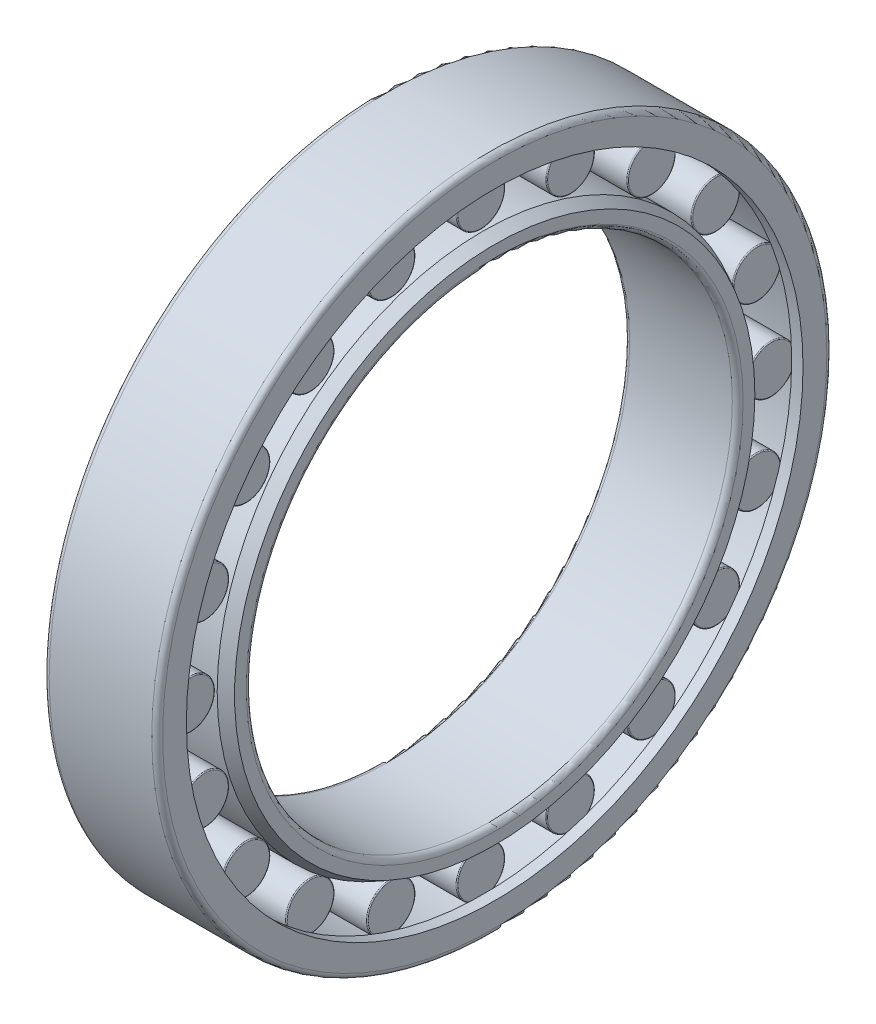
from build123d import *

# Parameters (mm, degrees)
ROLLERSDETAILED_COUNT = 20
ROLLERSDETAILED_ANGLE = 342


with BuildPart() as part:
    # OutRacSke → OuterRace (revolve)
    with BuildSketch(Plane.XY):
        with BuildLine():
            Line((-16.8, 114.18875), (-21, 114.18875))
            Line((-21, 114.18875), (-21, 123))
            ThreePointArc((-21, 123), (-20.414213562, 124.414213562), (-19, 125))
            Line((-19, 125), (19, 125))
            ThreePointArc((19, 125), (20.414213562, 124.414213562), (21, 123))
            Line((21, 123), (21, 114.18875))
            Line((21, 114.18875), (16.8, 114.18875))
            Line((16.8, 114.18875), (16.8, 116.42))
            Line((16.8, 116.42), (-16.8, 116.42))
            Line((-16.8, 116.42), (-16.8, 114.18875))
        make_face()
    revolve(axis=Axis((-90, 0, 0), (1, 0, 0)))

    # RolDetSke → RollerDetailed (revolve)
    with BuildSketch(Plane.XY):
        with BuildLine():
            Line((-15.96, 116.068), (-15.96, 107.5))
            Line((-15.96, 107.5), (15.96, 107.5))
            Line((15.96, 107.5), (15.96, 116.068))
            ThreePointArc((15.96, 116.068), (15.855437121, 116.320437121), (15.603, 116.425))
            Line((15.603, 116.425), (-15.603, 116.425))
            ThreePointArc((-15.603, 116.425), (-15.855437121, 116.320437121), (-15.96, 116.068))
        make_face()
    rollerdetailed = revolve(axis=Axis((-33.6, 107.5, 0), (1, 0, 0)))

    # InsRacSke → InnerRace (revolve)
    with BuildSketch(Plane.XY):
        with BuildLine():
            Line((-16.8, 98.58), (-21, 96.34875))
            Line((-21, 96.34875), (-21, 92))
            ThreePointArc((-21, 92), (-20.414213562, 90.585786438), (-19, 90))
            Line((-19, 90), (19, 90))
            ThreePointArc((19, 90), (20.414213562, 90.585786438), (21, 92))
            Line((21, 92), (21, 96.34875))
            Line((21, 96.34875), (16.8, 98.58))
            Line((16.8, 98.58), (-16.8, 98.58))
        make_face()
    revolve(axis=Axis((-90, 0, 0), (1, 0, 0)))

    # RollersDetailed: RollerDetailed ×20 about axis
    rollersdetailed_axis = Axis((-50, 0, 0), (1, 0, 0))
    for i in range(1, ROLLERSDETAILED_COUNT):
        add(rollerdetailed.rotate(rollersdetailed_axis, i * ROLLERSDETAILED_ANGLE / (ROLLERSDETAILED_COUNT - 1)))


solid = part.part
